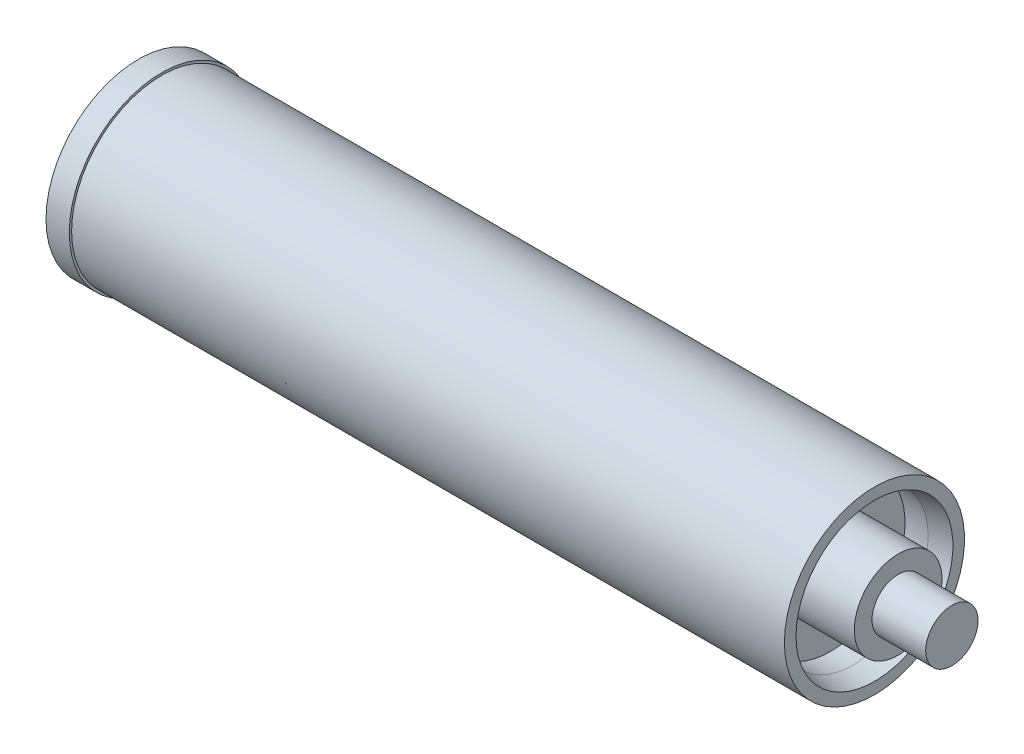
from build123d import *


with BuildPart() as part:
    # Esquisse2 → Révolution7 (revolve)
    with BuildSketch(Plane.XY):
        Polygon((0, 26), (12.7, 26), (36.56741584, 26), (36.56741584, 35.689138439), (25.4, 35.689138439), (12.7, 38.2095), (12.7, 50.419), (25.4, 50.419), (25.4, 49.149), (414.3502, 49.149), (414.3502, 42.820187711), (403.02734835, 40.573126289), (390.454818395, 40.573126289), (390.454818395, 23.9395), (427.3042, 23.9395), (427.3042, 14.2875), (456.5904, 14.2875), (456.5904, 0), (0, 0), align=None)
    revolve(axis=Axis((0, 0, 0), (1, 0, 0)))

    # Esquisse3 → Enlèvement de matière-Révolution1 (revolve, cut)
    with BuildSketch(Plane.XY):
        Polygon((0, 20), (0, 0), (390.090795287, 0), (390.454818395, 12.957757221), (381.061065959, 12.957757221), (381.061065959, 44.271024873), (65.871878934, 44.271024873), (34.08300614, 14.327580407), (19.08300614, 14.327580407), align=None)
    revolve(axis=Axis((0, 0, 0), (1, 0, 0)), mode=Mode.SUBTRACT)


solid = part.part
